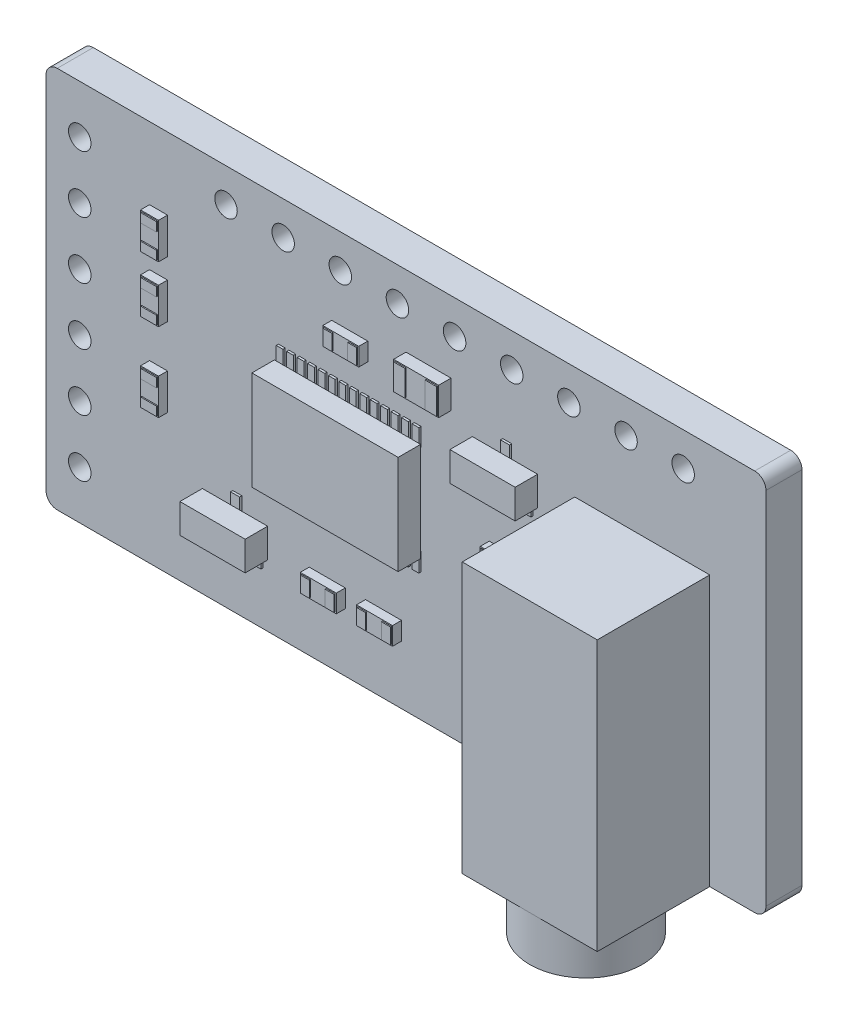
from build123d import *

# Parameters (mm, degrees)
PCB_DEPTH                    = 1.6
SKETCH2_W                    = 0.3
SKETCH2_H                    = 0.8
SKETCH2_W_2                  = 0.4
SKETCH2_H_2                  = 0.7
SMD_ADD00_DEPTH              = 0.1
SKETCH3_W                    = 0.8
SKETCH3_H                    = 1.6
SKETCH3_W_2                  = 1.6
SKETCH3_H_2                  = 0.8
SMD_ADD01_DEPTH              = 0.4
SKETCH4_W                    = 2
SKETCH4_H                    = 1.25
SMD_ADD02_DEPTH              = 0.55
SKETCH5_W                    = 6.5
SKETCH5_H                    = 4.4
SKETCH5_W_2                  = 2.9
SKETCH5_H_2                  = 1.3
SMD_ADD03_DEPTH              = 1
SKETCH6_W                    = 0.7
SKETCH6_H                    = 0.4
SKETCH6_W_2                  = 0.4
SKETCH6_H_2                  = 0.7
SMD_ADD04_DEPTH              = 0.05
SKETCH7_W                    = 0.5
SKETCH7_H                    = 1.15
SMD_ADD05_DEPTH              = 0.05
SKETCH8_W                    = 6
SKETCH8_H                    = 12
BODY00_DEPTH                 = 5
SKETCH9_R                    = 2.5
SIDE0_J1_JACK_NOSE_DEPTH     = 2
SKETCH10_R                   = 1.75
SIDEBORE0_J1_JACK_NOSE_DEPTH = 2
SKETCH11_R                   = 0.5
HOLES_DEPTH                  = 1.6


with BuildPart() as part:
    # Sketch1 → PCB (new body)
    with BuildSketch(Plane.XY):
        with BuildLine():
            Line((0.5, 0), (31.5, 0))
            ThreePointArc((31.5, 0), (31.853553391, 0.146446609), (32, 0.5))
            Line((32, 0.5), (32, 16.5))
            ThreePointArc((32, 16.5), (31.853553391, 16.853553391), (31.5, 17))
            Line((31.5, 17), (0.5, 17))
            ThreePointArc((0.5, 17), (0.146446609, 16.853553391), (0, 16.5))
            Line((0, 16.5), (0, 0.5))
            ThreePointArc((0, 0.5), (0.146446609, 0.146446609), (0.5, 0))
        make_face()
    extrude(amount=PCB_DEPTH)

    # Sketch2 → SMD_add00 (add)
    with BuildSketch(Plane.XY.offset(1.6)):
        with Locations((10.482142857, 6.1)):
            Rectangle(SKETCH2_W, SKETCH2_H)
        with Locations((10.946428571, 6.1)):
            Rectangle(SKETCH2_W, SKETCH2_H)
        with Locations((11.410714286, 6.1)):
            Rectangle(SKETCH2_W, SKETCH2_H)
        with Locations((11.875, 6.1)):
            Rectangle(SKETCH2_W, SKETCH2_H)
        with Locations((12.339285714, 6.1)):
            Rectangle(SKETCH2_W, SKETCH2_H)
        with Locations((12.803571429, 6.1)):
            Rectangle(SKETCH2_W, SKETCH2_H)
        with Locations((13.267857143, 6.1)):
            Rectangle(SKETCH2_W, SKETCH2_H)
        with Locations((13.732142857, 6.1)):
            Rectangle(SKETCH2_W, SKETCH2_H)
        with Locations((14.196428571, 6.1)):
            Rectangle(SKETCH2_W, SKETCH2_H)
        with Locations((14.660714286, 6.1)):
            Rectangle(SKETCH2_W, SKETCH2_H)
        with Locations((15.125, 6.1)):
            Rectangle(SKETCH2_W, SKETCH2_H)
        with Locations((15.589285714, 6.1)):
            Rectangle(SKETCH2_W, SKETCH2_H)
        with Locations((16.053571429, 6.1)):
            Rectangle(SKETCH2_W, SKETCH2_H)
        with Locations((16.517857143, 6.1)):
            Rectangle(SKETCH2_W, SKETCH2_H)
        with Locations((10.482142857, 10.9)):
            Rectangle(SKETCH2_W, SKETCH2_H)
        with Locations((10.946428571, 10.9)):
            Rectangle(SKETCH2_W, SKETCH2_H)
        with Locations((11.410714286, 10.9)):
            Rectangle(SKETCH2_W, SKETCH2_H)
        with Locations((11.875, 10.9)):
            Rectangle(SKETCH2_W, SKETCH2_H)
        with Locations((12.339285714, 10.9)):
            Rectangle(SKETCH2_W, SKETCH2_H)
        with Locations((12.803571429, 10.9)):
            Rectangle(SKETCH2_W, SKETCH2_H)
        with Locations((13.267857143, 10.9)):
            Rectangle(SKETCH2_W, SKETCH2_H)
        with Locations((13.732142857, 10.9)):
            Rectangle(SKETCH2_W, SKETCH2_H)
        with Locations((14.196428571, 10.9)):
            Rectangle(SKETCH2_W, SKETCH2_H)
        with Locations((14.660714286, 10.9)):
            Rectangle(SKETCH2_W, SKETCH2_H)
        with Locations((15.125, 10.9)):
            Rectangle(SKETCH2_W, SKETCH2_H)
        with Locations((15.589285714, 10.9)):
            Rectangle(SKETCH2_W, SKETCH2_H)
        with Locations((16.053571429, 10.9)):
            Rectangle(SKETCH2_W, SKETCH2_H)
        with Locations((16.517857143, 10.9)):
            Rectangle(SKETCH2_W, SKETCH2_H)
        with Locations((19.55, 10.7)):
            Rectangle(SKETCH2_W_2, SKETCH2_H_2)
        with Locations((21.45, 10.7)):
            Rectangle(SKETCH2_W_2, SKETCH2_H_2)
        with Locations((20.5, 12.3)):
            Rectangle(SKETCH2_W_2, SKETCH2_H_2)
        with Locations((7.55, 2.7)):
            Rectangle(SKETCH2_W_2, SKETCH2_H_2)
        with Locations((9.45, 2.7)):
            Rectangle(SKETCH2_W_2, SKETCH2_H_2)
        with Locations((8.5, 4.3)):
            Rectangle(SKETCH2_W_2, SKETCH2_H_2)
    extrude(amount=SMD_ADD00_DEPTH)

    # Sketch3 → SMD_add01 (add)
    with BuildSketch(Plane.XY.offset(1.6)):
        with Locations((5, 7)):
            Rectangle(SKETCH3_W, SKETCH3_H)
        with Locations((5, 10.5)):
            Rectangle(SKETCH3_W, SKETCH3_H)
        with Locations((5, 13)):
            Rectangle(SKETCH3_W, SKETCH3_H)
        with Locations((20.5, 8)):
            Rectangle(SKETCH3_W_2, SKETCH3_H_2)
        with Locations((20.5, 6)):
            Rectangle(SKETCH3_W_2, SKETCH3_H_2)
        with Locations((20.5, 4)):
            Rectangle(SKETCH3_W_2, SKETCH3_H_2)
        with Locations((15, 3)):
            Rectangle(SKETCH3_W_2, SKETCH3_H_2)
        with Locations((12.5, 3)):
            Rectangle(SKETCH3_W_2, SKETCH3_H_2)
        with Locations((13.5, 13)):
            Rectangle(SKETCH3_W_2, SKETCH3_H_2)
    extrude(amount=SMD_ADD01_DEPTH)

    # Sketch4 → SMD_add02 (add)
    with BuildSketch(Plane.XY.offset(1.6)):
        with Locations((17, 13.2)):
            Rectangle(SKETCH4_W, SKETCH4_H)
    extrude(amount=SMD_ADD02_DEPTH)

    # Sketch5 → SMD_add03 (add)
    with BuildSketch(Plane.XY.offset(1.7)):
        with Locations((13.5, 8.5)):
            Rectangle(SKETCH5_W, SKETCH5_H)
        with Locations((20.5, 11.5)):
            Rectangle(SKETCH5_W_2, SKETCH5_H_2)
        with Locations((8.5, 3.5)):
            Rectangle(SKETCH5_W_2, SKETCH5_H_2)
    extrude(amount=SMD_ADD03_DEPTH)

    # Sketch6 → SMD_add04 (add)
    with BuildSketch(Plane.XY.offset(2)):
        with Locations((5, 6.45)):
            Rectangle(SKETCH6_W, SKETCH6_H)
        with Locations((5, 7.55)):
            Rectangle(SKETCH6_W, SKETCH6_H)
        with Locations((5, 9.95)):
            Rectangle(SKETCH6_W, SKETCH6_H)
        with Locations((5, 11.05)):
            Rectangle(SKETCH6_W, SKETCH6_H)
        with Locations((5, 12.45)):
            Rectangle(SKETCH6_W, SKETCH6_H)
        with Locations((5, 13.55)):
            Rectangle(SKETCH6_W, SKETCH6_H)
        with Locations((19.95, 8)):
            Rectangle(SKETCH6_W_2, SKETCH6_H_2)
        with Locations((21.05, 8)):
            Rectangle(SKETCH6_W_2, SKETCH6_H_2)
        with Locations((19.95, 6)):
            Rectangle(SKETCH6_W_2, SKETCH6_H_2)
        with Locations((21.05, 6)):
            Rectangle(SKETCH6_W_2, SKETCH6_H_2)
        with Locations((19.95, 4)):
            Rectangle(SKETCH6_W_2, SKETCH6_H_2)
        with Locations((21.05, 4)):
            Rectangle(SKETCH6_W_2, SKETCH6_H_2)
        with Locations((14.45, 3)):
            Rectangle(SKETCH6_W_2, SKETCH6_H_2)
        with Locations((15.55, 3)):
            Rectangle(SKETCH6_W_2, SKETCH6_H_2)
        with Locations((11.95, 3)):
            Rectangle(SKETCH6_W_2, SKETCH6_H_2)
        with Locations((13.05, 3)):
            Rectangle(SKETCH6_W_2, SKETCH6_H_2)
        with Locations((12.95, 13)):
            Rectangle(SKETCH6_W_2, SKETCH6_H_2)
        with Locations((14.05, 13)):
            Rectangle(SKETCH6_W_2, SKETCH6_H_2)
    extrude(amount=SMD_ADD04_DEPTH)

    # Sketch7 → SMD_add05 (add)
    with BuildSketch(Plane.XY.offset(2.15)):
        with Locations((16.3, 13.2)):
            Rectangle(SKETCH7_W, SKETCH7_H)
        with Locations((17.7, 13.2)):
            Rectangle(SKETCH7_W, SKETCH7_H)
    extrude(amount=SMD_ADD05_DEPTH)

    # Sketch8 → Body00 (add)
    with BuildSketch(Plane.XY.offset(1.6)):
        with Locations((26.5, 6)):
            Rectangle(SKETCH8_W, SKETCH8_H)
    extrude(amount=BODY00_DEPTH)

    # Sketch9 → Side0_J1_jack_nose (add)
    with BuildSketch(Plane(origin=(0, 0, 0), x_dir=(1, 0, 0), z_dir=(0, 1, 0))):
        with Locations((26.5, -4.1)):
            Circle(SKETCH9_R)
    extrude(amount=-SIDE0_J1_JACK_NOSE_DEPTH)

    # Sketch10 → SideBore0_J1_jack_nose (cut)
    with BuildSketch(Plane(origin=(0, 0, 0), x_dir=(1, 0, 0), z_dir=(0, 1, 0))):
        with Locations((26.5, -4.1)):
            Circle(SKETCH10_R)
    extrude(amount=-SIDEBORE0_J1_JACK_NOSE_DEPTH, mode=Mode.SUBTRACT)

    # Sketch11 → Holes (cut)
    with BuildSketch(Plane.XY.offset(1.6)):
        with Locations((1.5, 2.15)):
            Circle(SKETCH11_R)
        with Locations((1.5, 4.69)):
            Circle(SKETCH11_R)
        with Locations((1.5, 7.23)):
            Circle(SKETCH11_R)
        with Locations((1.5, 9.77)):
            Circle(SKETCH11_R)
        with Locations((1.5, 12.31)):
            Circle(SKETCH11_R)
        with Locations((1.5, 14.85)):
            Circle(SKETCH11_R)
        with Locations((8, 15.5)):
            Circle(SKETCH11_R)
        with Locations((10.54, 15.5)):
            Circle(SKETCH11_R)
        with Locations((13.08, 15.5)):
            Circle(SKETCH11_R)
        with Locations((15.62, 15.5)):
            Circle(SKETCH11_R)
        with Locations((18.16, 15.5)):
            Circle(SKETCH11_R)
        with Locations((20.7, 15.5)):
            Circle(SKETCH11_R)
        with Locations((23.24, 15.5)):
            Circle(SKETCH11_R)
        with Locations((25.78, 15.5)):
            Circle(SKETCH11_R)
        with Locations((28.32, 15.5)):
            Circle(SKETCH11_R)
    extrude(amount=-HOLES_DEPTH, mode=Mode.SUBTRACT)


solid = part.part
